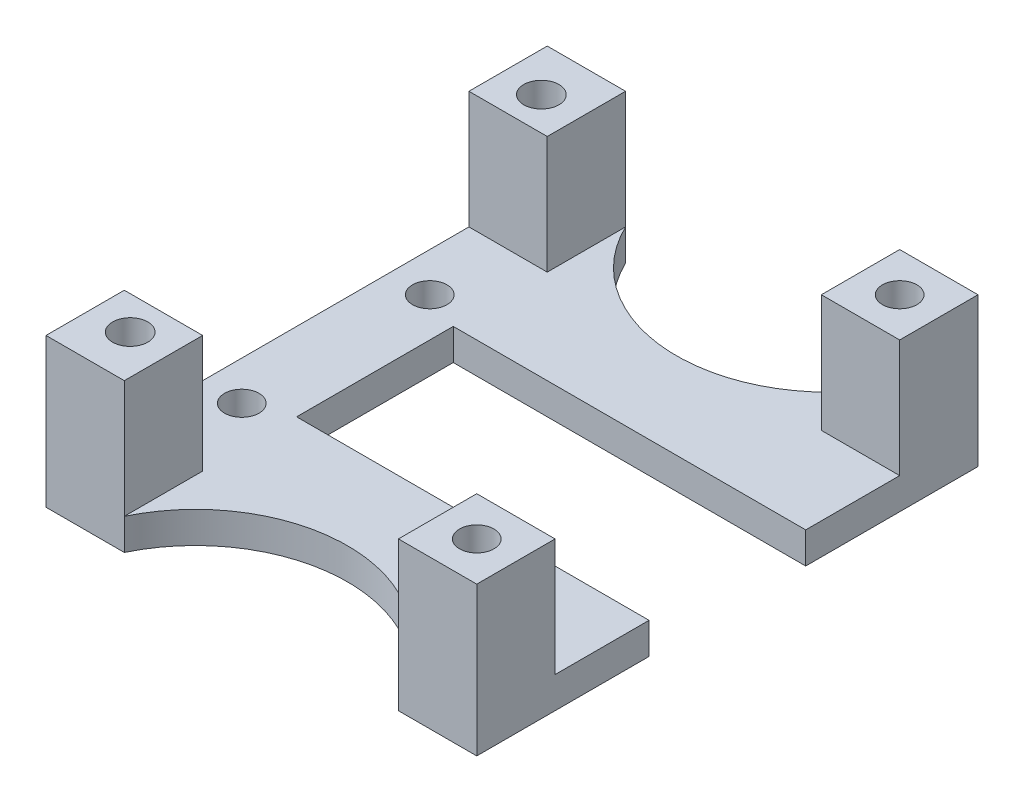
from build123d import *

# Parameters (mm, degrees)
SKETCH1_R                  = 2.2
SKETCH1_R_2                = 2.2479
EXTRUDE_BODY_DEPTH         = 4
SKETCH5_W                  = 10
SKETCH5_H                  = 10
SKETCH5_R                  = 2.2
SKETCH5_R_2                = 2.2479
EXTRUDE_LEGS_DEPTH         = 15
SKETCH6_R                  = 4.215
CUT_BOLT_HEAD_INSETS_DEPTH = 2.5


with BuildPart() as part:
    # Sketch1 → Extrude-Body (new body)
    with BuildSketch(Plane(origin=(0, 0, 0), x_dir=(1, 0, 0), z_dir=(0, 1, 0))):
        with BuildLine():
            Line((10, -10), (10, 10))
            Line((10, 10), (55, 10))
            Line((55, 10), (55, 32))
            Line((55, 32), (45, 32))
            ThreePointArc((45, 32), (27.5, 21), (10, 32))
            Line((10, 32), (0, 32))
            Line((0, 32), (0, -32))
            Line((0, -32), (10, -32))
            ThreePointArc((10, -32), (27.5, -21), (45, -32))
            Line((45, -32), (55, -32))
            Line((55, -32), (55, -10))
            Line((55, -10), (10, -10))
        make_face()
        with Locations((5, -12)):
            Circle(SKETCH1_R, mode=Mode.SUBTRACT)
        with Locations((5, 12)):
            Circle(SKETCH1_R, mode=Mode.SUBTRACT)
        with Locations((50, -27)):
            Circle(SKETCH1_R, mode=Mode.SUBTRACT)
        with Locations((5, -26.25)):
            Circle(SKETCH1_R_2, mode=Mode.SUBTRACT)
        with Locations((50, 27)):
            Circle(SKETCH1_R, mode=Mode.SUBTRACT)
        with Locations((5, 26.25)):
            Circle(SKETCH1_R_2, mode=Mode.SUBTRACT)
    extrude(amount=EXTRUDE_BODY_DEPTH)

    # Sketch5 → Extrude-Legs (add)
    # profile 1 of 4: a face of its own
    with BuildSketch(Plane(origin=(0, 4, 0), x_dir=(1, 0, 0), z_dir=(0, 1, 0))):
        with Locations((50, -27)):
            Rectangle(SKETCH5_W, SKETCH5_H)
        with Locations((50, -27)):
            Circle(SKETCH5_R, mode=Mode.SUBTRACT)
    # profile 2 of 4: a face of its own
    with BuildSketch(Plane(origin=(0, 4, 0), x_dir=(1, 0, 0), z_dir=(0, 1, 0))):
        with Locations((50, 27)):
            Rectangle(SKETCH5_W, SKETCH5_H)
        with Locations((50, 27)):
            Circle(SKETCH5_R, mode=Mode.SUBTRACT)
    # profile 3 of 4: a face of its own
    with BuildSketch(Plane(origin=(0, 4, 0), x_dir=(1, 0, 0), z_dir=(0, 1, 0))):
        with Locations((5, 27)):
            Rectangle(SKETCH5_W, SKETCH5_H)
        with Locations((5, 26.25)):
            Circle(SKETCH5_R_2, mode=Mode.SUBTRACT)
    # profile 4 of 4: a face of its own
    with BuildSketch(Plane(origin=(0, 4, 0), x_dir=(1, 0, 0), z_dir=(0, 1, 0))):
        with Locations((5, -27)):
            Rectangle(SKETCH5_W, SKETCH5_H)
        with Locations((5, -26.25)):
            Circle(SKETCH5_R_2, mode=Mode.SUBTRACT)
    extrude(amount=EXTRUDE_LEGS_DEPTH)

    # Sketch6 → Cut-Bolt Head Insets (cut)
    with BuildSketch(Plane.XZ):
        with Locations((5, -26.25)):
            Circle(SKETCH6_R)
        with Locations((5, 26.25)):
            Circle(SKETCH6_R)
        with Locations((50, 27)):
            Circle(SKETCH6_R)
        with Locations((50, -27)):
            Circle(SKETCH6_R)
    extrude(amount=-CUT_BOLT_HEAD_INSETS_DEPTH, mode=Mode.SUBTRACT)


solid = part.part
